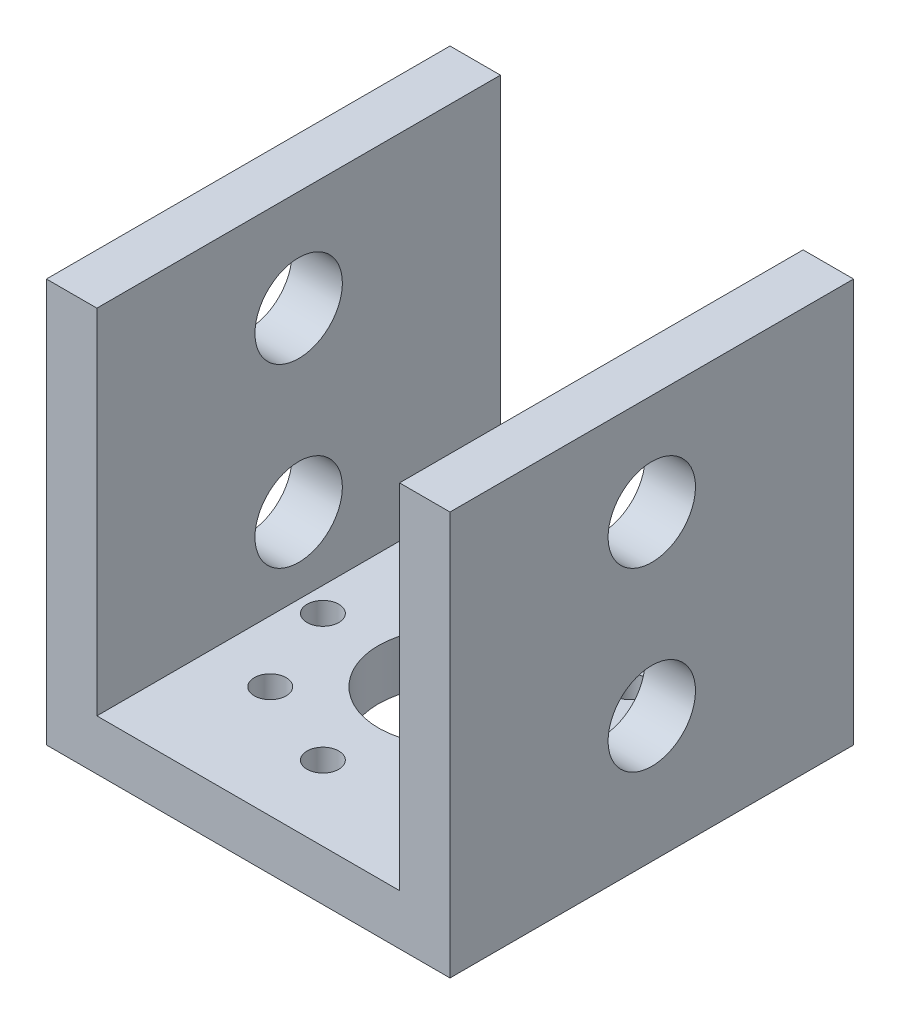
from build123d import *

# Parameters (mm, degrees)
BOSS_EXTRUDE1_DEPTH   = 25.4
SKETCH2_R             = 2.75
CUT_EXTRUDE1_DEPTH    = 43.240627659
SKETCH3_R             = 4.500000017
CUT_EXTRUDE2_DEPTH    = 37.061067996
F_2_0MM_DOWEL_HOLE1_D = 2


with BuildPart() as part:
    # Sketch1 → Boss-Extrude1 (new body)
    with BuildSketch(Plane.XY):
        Polygon((-9.525, 0), (9.525, 0), (9.525, 22.225), (12.7, 22.225), (12.7, -3.175), (-12.7, -3.175), (-12.7, 22.225), (-9.525, 22.225), align=None)
    extrude(amount=BOSS_EXTRUDE1_DEPTH)

    # Sketch2 → Cut-Extrude1 (cut, through all)
    with BuildSketch(Plane(origin=(12.7, 0, 0), x_dir=(0, 0, -1), z_dir=(1, 0, 0))):
        with Locations((-12.7, 15.875)):
            Circle(SKETCH2_R)
        with Locations((-12.7, 4.7625)):
            Circle(SKETCH2_R)
    extrude(amount=-CUT_EXTRUDE1_DEPTH, mode=Mode.SUBTRACT)

    # Sketch3 → Cut-Extrude2 (cut, through all)
    with BuildSketch(Plane(origin=(0, 0, 0), x_dir=(1, 0, 0), z_dir=(0, 1, 0))):
        with Locations((0, -12.7)):
            Circle(SKETCH3_R)
    extrude(amount=-CUT_EXTRUDE2_DEPTH, mode=Mode.SUBTRACT)

    # Ø2.0mm Dowel Hole1 (through all)
    with Locations(Plane(origin=(0, 0, 0), x_dir=(1, 0, 0), z_dir=(0, 1, 0))):
        with Locations((0, -4.699999998), (5.656854251, -7.043145749), (8.000000002, -12.7), (5.656854251, -18.356854251), (0, -20.700000002), (-5.656854251, -18.356854251), (-8.000000002, -12.7), (-5.656854251, -7.043145749)):
            Hole(F_2_0MM_DOWEL_HOLE1_D / 2)


solid = part.part
